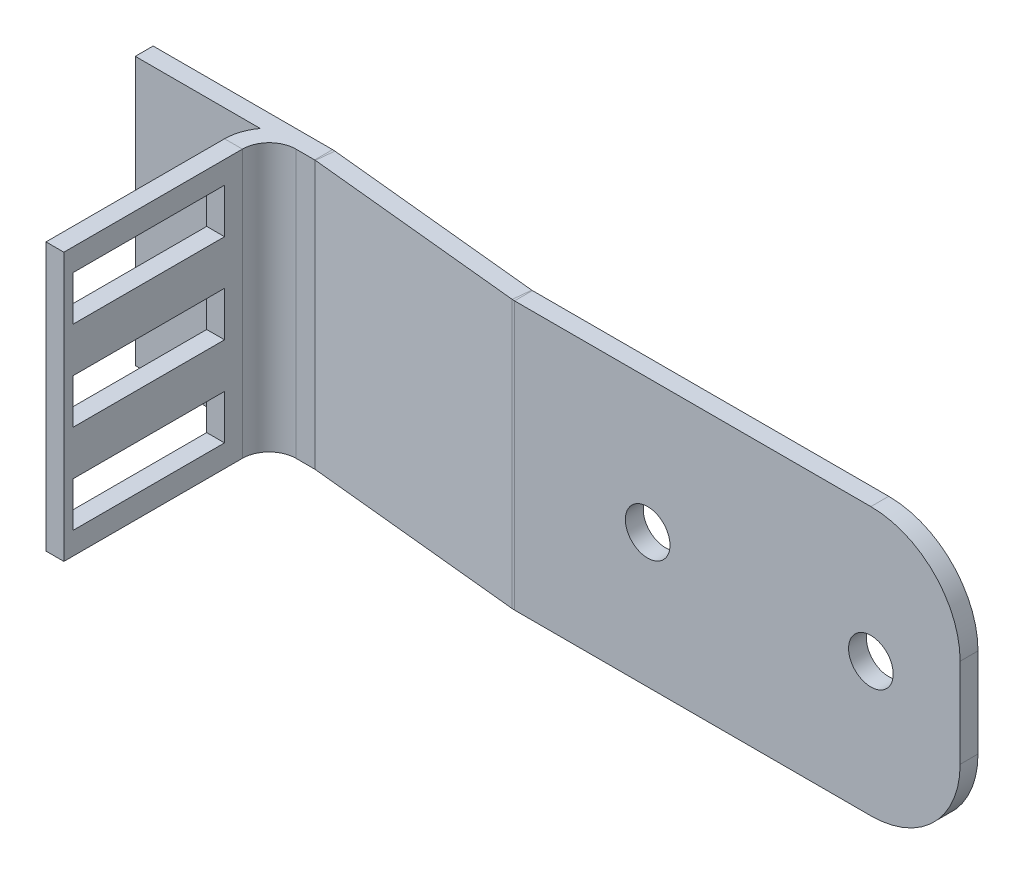
from build123d import *

# Parameters (mm, degrees)
SKETCH1_W                    = 80
SKETCH1_H                    = 30
SKETCH1_R                    = 2.5
BASE_FLANGE1_DEPTH           = 2
FILLET1_R                    = 10
EDGE_FLANGE1_STRIP_W         = 14
EDGE_FLANGE1_STRIP_H         = 2
EDGE_FLANGE1_STRIP_CUT_DEPTH = 30
EDGE_FLANGE1_DEPTH           = 30
SKETCH9_W                    = 17
SKETCH9_H                    = 5
CUT_EXTRUDE1_DEPTH           = 10
SKETCHED_START               = -15
SKETCHED_BEND1_DEPTH         = 30
SKETCHED_START_2             = -12.5
SKETCHED_BEND1_2_DEPTH       = 5
SKETCHED_START_3             = -2.5
SKETCHED_BEND1_3_DEPTH       = 5
SKETCHED_START_4             = 7.5
SKETCHED_BEND1_4_DEPTH       = 5
SKETCHED_BEND1_5_DEPTH       = 30
SKETCHED_START_5             = -7.5
SKETCHED_BEND1_6_DEPTH       = 5
SKETCHED_START_6             = 2.5
SKETCHED_BEND1_7_DEPTH       = 5
SKETCHED_BEND1_8_DEPTH       = 2.5
SKETCHED_START_7             = 12.5
SKETCHED_BEND1_9_DEPTH       = 2.5
SKETCHED_BEND4_DEPTH         = 30
SKETCHED_BEND4_2_OUTLINE_W   = 2
SKETCHED_BEND4_2_OUTLINE_H   = 1
SKETCHED_BEND4_2_DEPTH       = 30
SKETCHED_BEND4_3_DEPTH       = 5
SKETCHED_BEND4_4_DEPTH       = 5
SKETCHED_BEND4_5_DEPTH       = 2.5
SKETCHED_BEND4_6_DEPTH       = 2.5
SKETCH18_W                   = 18
SKETCH18_H                   = 30
BOSS_EXTRUDE2_DEPTH          = 2


# Read off the part's stored shape, not the designer's step: Sketched Bend1, Sketched Bend4
# Sheet-metal steps are written as plain solids
with BuildPart() as part:
    # Sketch1 → Base-Flange1 (new body)
    with BuildSketch(Plane.XY):
        Rectangle(SKETCH1_W, SKETCH1_H)
        with Locations((30, 0)):
            Circle(SKETCH1_R, mode=Mode.SUBTRACT)
        with Locations((5, 0)):
            Circle(SKETCH1_R, mode=Mode.SUBTRACT)
    extrude(amount=-BASE_FLANGE1_DEPTH)

    # Fillet1
    fillet1_edges = [part.edges().sort_by_distance(p)[0] for p in [
        (40, -15, -1),
        (40, 15, -1),
    ]]
    fillet(fillet1_edges, radius=FILLET1_R)

    # Edge-Flange1 strip (across the edge) → Edge-Flange1 strip cut (cut)
    with BuildSketch(Plane(origin=(-40, 15, 0), x_dir=(1, 0, 0), z_dir=(0, -1, 0))):
        with Locations((-4, -1)):
            Rectangle(EDGE_FLANGE1_STRIP_W, EDGE_FLANGE1_STRIP_H)
    extrude(amount=EDGE_FLANGE1_STRIP_CUT_DEPTH, mode=Mode.SUBTRACT)

    # Edge-Flange1 section (across the edge) → Edge-Flange1 (add)
    with BuildSketch(Plane(origin=(-40, 15, 0), x_dir=(1, 0, 0), z_dir=(0, -1, 0))):
        with BuildLine():
            Line((-2, 3), (-2, 23))
            Line((-2, 23), (0, 23))
            Line((0, 23), (0, 3))
            ThreePointArc((0, 3), (0.878679656, 0.878679656), (3, 0))
            Line((3, 0), (3, -2))
            ThreePointArc((3, -2), (-0.535533906, -0.535533906), (-2, 3))
        make_face()
    extrude(amount=EDGE_FLANGE1_DEPTH)

    # Sketch9 → Cut-Extrude1 (cut)
    with BuildSketch(Plane.ZY.offset(42)):
        with Locations((13.5, 10)):
            Rectangle(SKETCH9_W, SKETCH9_H)
        with Locations((13.5, 0)):
            Rectangle(SKETCH9_W, SKETCH9_H)
        with Locations((13.5, -10)):
            Rectangle(SKETCH9_W, SKETCH9_H)
    extrude(amount=-CUT_EXTRUDE1_DEPTH, mode=Mode.SUBTRACT)

    # Sketched Bend1 outline → Sketched Bend1 (cut)
    with BuildSketch(Plane(origin=(0, 0, 0), x_dir=(1, 0, 0), z_dir=(0, 1, 0)).offset(SKETCHED_START)):
        with BuildLine():
            Line((-10.18667911, 0.013716565), (-29.950540767, 2))
            Line((-29.950540767, 2), (-37, 2))
            ThreePointArc((-37, 2), (-38.560982046, 1.750087899), (-39.965920771, 1.025334021))
            ThreePointArc((-39.965920771, 1.025334021), (-40.15194126, 0.535100989), (-40.24976541, 0.019967526))
            Line((-40.24976541, 0.019967526), (-42, -17.395167538))
            Line((-42, -17.395167538), (-42, -23))
            Line((-42, -23), (-40, -23))
            Line((-40, -23), (-40, -3))
            ThreePointArc((-40, -3), (-39.121320344, -0.878679656), (-37, 0))
            Line((-37, 0), (-9.913027212, 0))
            ThreePointArc((-9.913027212, 0), (-10.050024936, 0.003431293), (-10.18667911, 0.013716565))
        make_face()
    extrude(amount=SKETCHED_BEND1_DEPTH, mode=Mode.SUBTRACT)

    # Sketched Bend1 2 outline → Sketched Bend1 2 (cut)
    with BuildSketch(Plane(origin=(0, 0, 0), x_dir=(1, 0, 0), z_dir=(0, 1, 0)).offset(SKETCHED_START_2)):
        with BuildLine():
            Line((-40.449759489, -1.970007943), (-41.860749959, -1.828202306))
            ThreePointArc((-41.860749959, -1.828202306), (-41.965065447, -2.409978727), (-42, -3))
            Line((-42, -3), (-42, -5))
            Line((-42, -5), (-40.754276042, -5))
            Line((-40.754276042, -5), (-40.449759489, -1.970007943))
        make_face()
    extrude(amount=SKETCHED_BEND1_2_DEPTH, mode=Mode.SUBTRACT)

    # Sketched Bend1 3 outline → Sketched Bend1 3 (cut)
    with BuildSketch(Plane(origin=(0, 0, 0), x_dir=(1, 0, 0), z_dir=(0, 1, 0)).offset(SKETCHED_START_3)):
        with BuildLine():
            Line((-40.449759489, -1.970007943), (-41.860749959, -1.828202306))
            ThreePointArc((-41.860749959, -1.828202306), (-41.965065447, -2.409978727), (-42, -3))
            Line((-42, -3), (-42, -5))
            Line((-42, -5), (-40.754276042, -5))
            Line((-40.754276042, -5), (-40.449759489, -1.970007943))
        make_face()
    extrude(amount=SKETCHED_BEND1_3_DEPTH, mode=Mode.SUBTRACT)

    # Sketched Bend1 4 outline → Sketched Bend1 4 (cut)
    with BuildSketch(Plane(origin=(0, 0, 0), x_dir=(1, 0, 0), z_dir=(0, 1, 0)).offset(SKETCHED_START_4)):
        with BuildLine():
            Line((-40.449759489, -1.970007943), (-41.860749959, -1.828202306))
            ThreePointArc((-41.860749959, -1.828202306), (-41.965065447, -2.409978727), (-42, -3))
            Line((-42, -3), (-42, -5))
            Line((-42, -5), (-40.754276042, -5))
            Line((-40.754276042, -5), (-40.449759489, -1.970007943))
        make_face()
    extrude(amount=SKETCHED_BEND1_4_DEPTH, mode=Mode.SUBTRACT)

    # Sketched Bend1 5 outline → Sketched Bend1 5 (add)
    with BuildSketch(Plane(origin=(0, 0, 0), x_dir=(1, 0, 0), z_dir=(0, 1, 0)).offset(SKETCHED_START)):
        with BuildLine():
            Line((-9.986685031, 2.003692035), (-36.764817009, 4.69491508))
            ThreePointArc((-36.764817009, 4.69491508), (-40.429072155, 3.591332203), (-42.23974088, 0.219961605))
            Line((-42.23974088, 0.219961605), (-42.439734959, -1.770013864))
            Line((-42.439734959, -1.770013864), (-41.860749959, -1.828202306))
            ThreePointArc((-41.860749959, -1.828202306), (-41.165316443, -0.234111548), (-39.965920771, 1.025334021))
            ThreePointArc((-39.965920771, 1.025334021), (-38.729937691, 2.33787213), (-36.964811088, 2.704939611))
            Line((-36.964811088, 2.704939611), (-29.950540767, 2))
            Line((-29.950540767, 2), (-9.913027212, 2))
            ThreePointArc((-9.913027212, 2), (-9.949902357, 2.000923588), (-9.986685031, 2.003692035))
        make_face()
        Polygon((-42.149709161, -18.884799432), (-44.139684631, -18.684805353), (-44.23968167, -19.679793088), (-42.249706201, -19.879787167), align=None)
    extrude(amount=SKETCHED_BEND1_5_DEPTH)

    # Sketched Bend1 6 outline → Sketched Bend1 6 (add)
    with BuildSketch(Plane(origin=(0, 0, 0), x_dir=(1, 0, 0), z_dir=(0, 1, 0)).offset(SKETCHED_START_5)):
        with BuildLine():
            Line((-41.860749959, -1.828202306), (-42.439734959, -1.770013864))
            Line((-42.439734959, -1.770013864), (-44.13968463, -18.684805353))
            Line((-44.13968463, -18.684805353), (-42.149709161, -18.884799432))
            Line((-42.149709161, -18.884799432), (-42, -17.395167538))
            Line((-42, -17.395167538), (-42, -3))
            ThreePointArc((-42, -3), (-41.965065447, -2.409978727), (-41.860749959, -1.828202306))
        make_face()
    extrude(amount=SKETCHED_BEND1_6_DEPTH)

    # Sketched Bend1 7 outline → Sketched Bend1 7 (add)
    with BuildSketch(Plane(origin=(0, 0, 0), x_dir=(1, 0, 0), z_dir=(0, 1, 0)).offset(SKETCHED_START_6)):
        with BuildLine():
            Line((-41.860749959, -1.828202306), (-42.439734959, -1.770013864))
            Line((-42.439734959, -1.770013864), (-44.13968463, -18.684805353))
            Line((-44.13968463, -18.684805353), (-42.149709161, -18.884799432))
            Line((-42.149709161, -18.884799432), (-42, -17.395167538))
            Line((-42, -17.395167538), (-42, -3))
            ThreePointArc((-42, -3), (-41.965065447, -2.409978727), (-41.860749959, -1.828202306))
        make_face()
    extrude(amount=SKETCHED_BEND1_7_DEPTH)

    # Sketched Bend1 8 outline → Sketched Bend1 8 (add)
    with BuildSketch(Plane(origin=(0, 0, 0), x_dir=(1, 0, 0), z_dir=(0, 1, 0)).offset(SKETCHED_START)):
        with BuildLine():
            Line((-41.860749959, -1.828202306), (-42.439734959, -1.770013864))
            Line((-42.439734959, -1.770013864), (-44.13968463, -18.684805353))
            Line((-44.13968463, -18.684805353), (-42.149709161, -18.884799432))
            Line((-42.149709161, -18.884799432), (-42, -17.395167538))
            Line((-42, -17.395167538), (-42, -3))
            ThreePointArc((-42, -3), (-41.965065447, -2.409978727), (-41.860749959, -1.828202306))
        make_face()
    extrude(amount=SKETCHED_BEND1_8_DEPTH)

    # Sketched Bend1 9 outline → Sketched Bend1 9 (add)
    with BuildSketch(Plane(origin=(0, 0, 0), x_dir=(1, 0, 0), z_dir=(0, 1, 0)).offset(SKETCHED_START_7)):
        with BuildLine():
            Line((-41.860749959, -1.828202306), (-42.439734959, -1.770013864))
            Line((-42.439734959, -1.770013864), (-44.13968463, -18.684805353))
            Line((-44.13968463, -18.684805353), (-42.149709161, -18.884799432))
            Line((-42.149709161, -18.884799432), (-42, -17.395167538))
            Line((-42, -17.395167538), (-42, -3))
            ThreePointArc((-42, -3), (-41.965065447, -2.409978727), (-41.860749959, -1.828202306))
        make_face()
    extrude(amount=SKETCHED_BEND1_9_DEPTH)

    # Sketched Bend4 outline → Sketched Bend4 (cut)
    with BuildSketch(Plane(origin=(0, 0, 0), x_dir=(1, 0, 0), z_dir=(0, 1, 0)).offset(SKETCHED_START)):
        with BuildLine():
            Line((-41.875919477, -16.160545003), (-41.875919477, -0.518726813))
            ThreePointArc((-41.875919477, -0.518726813), (-40.411453383, 3.016807093), (-36.875919477, 4.481273187))
            Line((-36.875919477, 4.481273187), (-34.776213155, 4.481273187))
            ThreePointArc((-34.776213155, 4.481273187), (-34.639215431, 4.477841895), (-34.502561257, 4.467556622))
            Line((-34.502561257, 4.467556622), (-36.764817009, 4.69491508))
            ThreePointArc((-36.764817009, 4.69491508), (-40.429072155, 3.591332203), (-42.23974088, 0.219961605))
            Line((-42.23974088, 0.219961605), (-44.23968167, -19.679793088))
            Line((-44.23968167, -19.679793088), (-42.249706201, -19.879787167))
            Line((-42.249706201, -19.879787167), (-41.875919477, -16.160545003))
        make_face()
    extrude(amount=SKETCHED_BEND4_DEPTH, mode=Mode.SUBTRACT)

    # Sketched Bend4 2 outline → Sketched Bend4 2 (add)
    with BuildSketch(Plane(origin=(0, 0, 0), x_dir=(1, 0, 0), z_dir=(0, 1, 0)).offset(SKETCHED_START)):
        with BuildLine():
            ThreePointArc((-39.875919477, -0.518726813), (-38.997239821, 1.602593531), (-36.875919477, 2.481273187))
            Line((-36.875919477, 2.481273187), (-34.776213155, 2.481273187))
            ThreePointArc((-34.776213155, 2.481273187), (-34.73933801, 2.480349599), (-34.702555336, 2.477581152))
            Line((-34.702555336, 2.477581152), (-36.964811088, 2.704939611))
            ThreePointArc((-36.964811088, 2.704939611), (-39.163364175, 2.042789885), (-40.24976541, 0.019967526))
            Line((-40.24976541, 0.019967526), (-40.449759489, -1.970007943))
            Line((-40.449759489, -1.970007943), (-41.875919477, -1.826677757))
            Line((-41.875919477, -1.826677757), (-41.875919477, -2.518726813))
            Line((-41.875919477, -2.518726813), (-39.875919477, -2.518726813))
            Line((-39.875919477, -2.518726813), (-39.875919477, -0.518726813))
        make_face()
        with Locations((-40.875919477, -20.018726813)):
            Rectangle(SKETCHED_BEND4_2_OUTLINE_W, SKETCHED_BEND4_2_OUTLINE_H)
    extrude(amount=SKETCHED_BEND4_2_DEPTH)

    # Sketched Bend4 3 outline → Sketched Bend4 3 (add)
    with BuildSketch(Plane(origin=(0, 0, 0), x_dir=(1, 0, 0), z_dir=(0, 1, 0)).offset(SKETCHED_START_5)):
        Polygon((-39.875919477, -19.518726813), (-39.875919477, -2.518726813), (-40.504906161, -2.518726813), (-41.875919477, -16.160545003), (-41.875919477, -19.518726813), align=None)
    extrude(amount=SKETCHED_BEND4_3_DEPTH)

    # Sketched Bend4 4 outline → Sketched Bend4 4 (add)
    with BuildSketch(Plane(origin=(0, 0, 0), x_dir=(1, 0, 0), z_dir=(0, 1, 0)).offset(SKETCHED_START_6)):
        Polygon((-39.875919477, -19.518726813), (-39.875919477, -2.518726813), (-40.504906161, -2.518726813), (-41.875919477, -16.160545003), (-41.875919477, -19.518726813), align=None)
    extrude(amount=SKETCHED_BEND4_4_DEPTH)

    # Sketched Bend4 5 outline → Sketched Bend4 5 (add)
    with BuildSketch(Plane(origin=(0, 0, 0), x_dir=(1, 0, 0), z_dir=(0, 1, 0)).offset(SKETCHED_START)):
        Polygon((-39.875919477, -19.518726813), (-39.875919477, -2.518726813), (-40.504906161, -2.518726813), (-41.875919477, -16.160545003), (-41.875919477, -19.518726813), align=None)
    extrude(amount=SKETCHED_BEND4_5_DEPTH)

    # Sketched Bend4 6 outline → Sketched Bend4 6 (add)
    with BuildSketch(Plane(origin=(0, 0, 0), x_dir=(1, 0, 0), z_dir=(0, 1, 0)).offset(SKETCHED_START_7)):
        Polygon((-39.875919477, -19.518726813), (-39.875919477, -2.518726813), (-40.504906161, -2.518726813), (-41.875919477, -16.160545003), (-41.875919477, -19.518726813), align=None)
    extrude(amount=SKETCHED_BEND4_6_DEPTH)

    # Sketch18 → Boss-Extrude2 (add)
    with BuildSketch(Plane(origin=(0, 0, -4.481273187), x_dir=(-1, 0, 0), z_dir=(0, 0, -1))):
        with Locations((45.875919477, 0)):
            Rectangle(SKETCH18_W, SKETCH18_H)
    extrude(amount=-BOSS_EXTRUDE2_DEPTH)


solid = part.part
